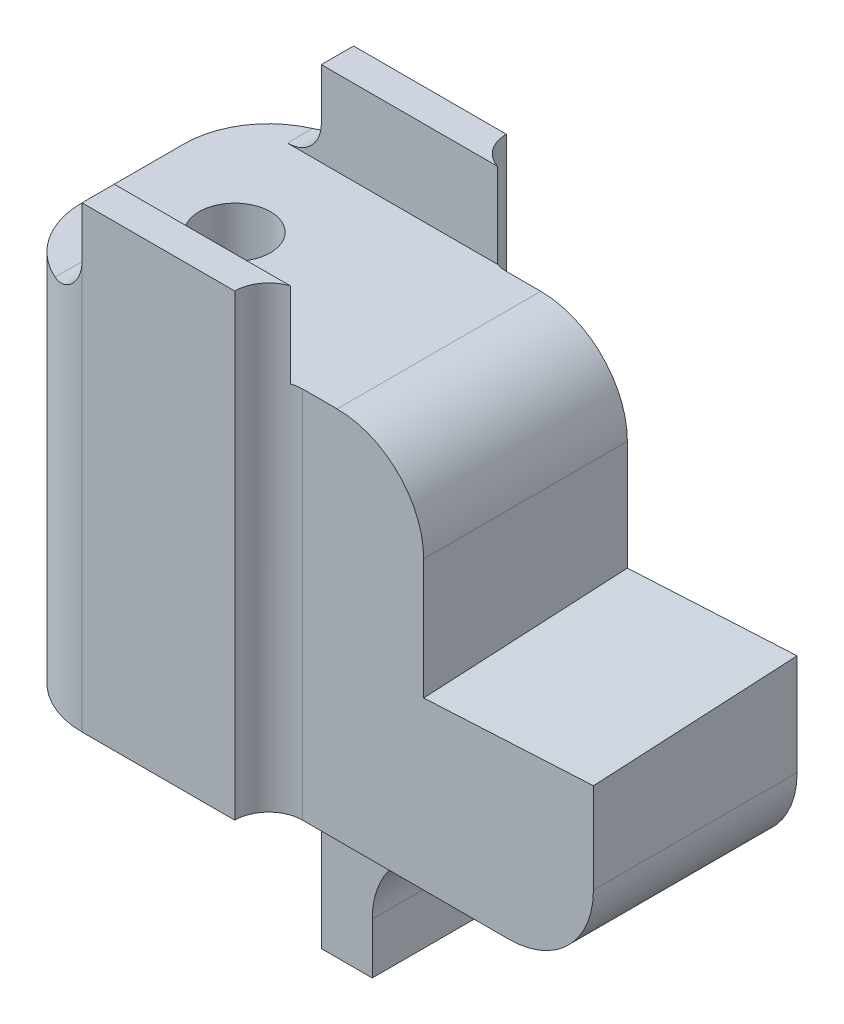
from build123d import *

# Parameters (mm, degrees)
SKETCH1_W           = 12
SKETCH1_H           = 16
SKETCH1_R           = 2.1
SKETCH1_W_2         = 2
BOSS_EXTRUDE1_DEPTH = 22
FILLET1_R           = 5
SKETCH2_W           = 9
SKETCH2_H           = 1.9
BOSS_EXTRUDE2_DEPTH = 5
SKETCH4_W           = 12
SKETCH4_H           = 22
BOSS_EXTRUDE3_DEPTH = 9.13
FILLET2_R           = 5.1
SKETCH5_W           = 3
SKETCH5_H           = 8
BOSS_EXTRUDE4_DEPTH = 8
FILLET3_R           = 2
BOSS_EXTRUDE5_DEPTH = 10
BOSS_EXTRUDE6_DEPTH = 12.016468152
FILLET4_R           = 5
FILLET5_R           = 2
FILLET6_R           = 5


with BuildPart() as part:
    # Sketch1 → Boss-Extrude1 (new body)
    # profile 1 of 2: a face of its own
    with BuildSketch(Plane(origin=(0, 0, 0), x_dir=(1, 0, 0), z_dir=(0, 1, 0))):
        Rectangle(SKETCH1_W, SKETCH1_H)
        with Locations(Location((0, 0, 0), (0, 0, 270))):
            Circle(SKETCH1_R, mode=Mode.SUBTRACT)
    # profile 2 of 2: a face of its own
    with BuildSketch(Plane(origin=(0, 0, 0), x_dir=(1, 0, 0), z_dir=(0, 1, 0))):
        with Locations((7, 0)):
            Rectangle(SKETCH1_W_2, SKETCH1_H)
    extrude(amount=BOSS_EXTRUDE1_DEPTH)

    # Fillet1
    fillet1_edges = [part.edges().sort_by_distance(p)[0] for p in [
        (-6, 11, 8),
        (-6, 11, -8),
    ]]
    fillet(fillet1_edges, radius=FILLET1_R)

    # Sketch2 → Boss-Extrude2 (add)
    with BuildSketch(Plane(origin=(0, 22, 0), x_dir=(1, 0, 0), z_dir=(0, 1, 0))):
        with Locations((3.5, 7.05)):
            Rectangle(SKETCH2_W, SKETCH2_H)
        with Locations((3.5, -7.05)):
            Rectangle(SKETCH2_W, SKETCH2_H)
    extrude(amount=BOSS_EXTRUDE2_DEPTH)

    # Sketch4 → Boss-Extrude3 (add)
    with BuildSketch(Plane(origin=(8, 0, 0), x_dir=(0, 0, -1), z_dir=(1, 0, 0))):
        with Locations((0, 11)):
            Rectangle(SKETCH4_W, SKETCH4_H)
    extrude(amount=BOSS_EXTRUDE3_DEPTH)

    # Fillet2
    fillet2_edges = [part.edges().sort_by_distance(p)[0] for p in [
        (17.13, 22, 0),
    ]]
    fillet(fillet2_edges, radius=FILLET2_R)

    # Sketch5 → Boss-Extrude4 (add)
    with BuildSketch(Plane.XZ):
        with Locations((10.6, 0)):
            Rectangle(SKETCH5_W, SKETCH5_H)
    extrude(amount=BOSS_EXTRUDE4_DEPTH)

    # Fillet3
    fillet3_edges = [part.edges().sort_by_distance(p)[0] for p in [
        (10.6, 0, 4),
        (10.6, 0, -4),
    ]]
    fillet(fillet3_edges, radius=FILLET3_R - 0.0001)  # a hair under: the kernel refuses the full size

    # Sketch6 → Boss-Extrude5 (add)
    with BuildSketch(Plane(origin=(17.13, 0, 0), x_dir=(0, 0, -1), z_dir=(1, 0, 0))):
        Polygon((-6, 9.8), (6, 10.428893351), (6, 0), (-6, 0), align=None)
    extrude(amount=BOSS_EXTRUDE5_DEPTH)

    # Sketch8 → Boss-Extrude6 (add, along a direction that is not the sketch's normal)
    with BuildSketch(Plane.XY.offset(6)):
        Polygon((17.13, 9.8), (27.13, 10.324077793), (27.13, 9.8), align=None)
    extrude(amount=-BOSS_EXTRUDE6_DEPTH, dir=(0, -0.052335956242944494, 0.9986295347545739))

    # Fillet4
    fillet4_edges = [part.edges().sort_by_distance(p)[0] for p in [
        (12.1, 0, 0),
    ]]
    fillet(fillet4_edges, radius=FILLET4_R)

    # Fillet5
    fillet5_edges = [part.edges().sort_by_distance(p)[0] for p in [
        (-1, 22, -7.05),
        (-1, 22, 7.05),
        (8, 11, -6),
        (8, 11, 6),
    ]]
    fillet(fillet5_edges, radius=FILLET5_R - 0.0001)  # a hair under: the kernel refuses the full size

    # Fillet6
    fillet6_edges = [part.edges().sort_by_distance(p)[0] for p in [
        (27.13, 0, 0),
    ]]
    fillet(fillet6_edges, radius=FILLET6_R)


solid = part.part
